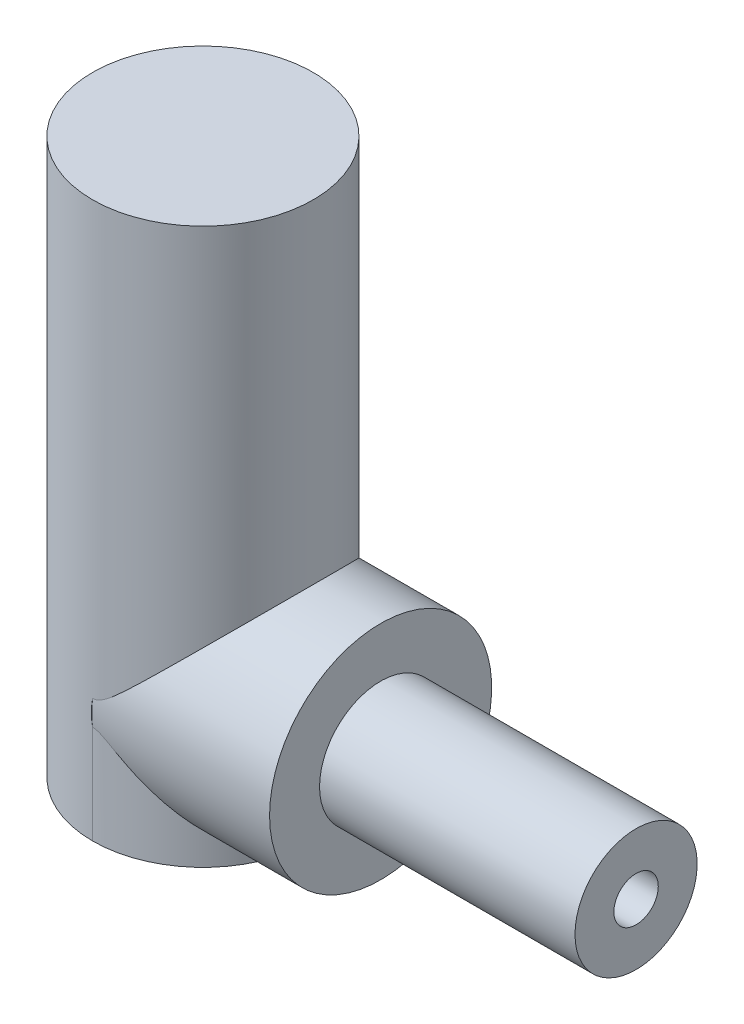
from build123d import *

# Parameters (mm, degrees)
SKETCH_2_R           = 1
CUT_EXTRUDE_1_DEPTH  = 8
EXTRUDE_1_DEPTH      = 20
EXTRUDE_1_DEPTH_BACK = 5
SKETCH_3_R           = 4.968098717


with BuildPart() as part:
    # 草图1 → 旋转2 (revolve)
    with BuildSketch(Plane(origin=(0, 0, 0), x_dir=(1, 0, 0), z_dir=(0, 1, 0))):
        Polygon((11.5, 0), (11.5, 2.75), (0, 2.75), (0, 5), (-8, 5), (-11, 3.25), (-11, 0), align=None)
    revolve(axis=Axis((-52.597365488, 0, 0), (1, 0, 0)))

    # 草图2 → 切除-拉伸1 (cut)
    with BuildSketch(Plane(origin=(11.5, 0, 0), x_dir=(0, 0, -1), z_dir=(1, 0, 0))):
        Circle(SKETCH_2_R)
    extrude(amount=-CUT_EXTRUDE_1_DEPTH, mode=Mode.SUBTRACT)

    # 草图3 → 凸台-拉伸1 (add, two sides: drawn at the far end of the back side and taken through both)
    with BuildSketch(Plane(origin=(0, 0, 0), x_dir=(1, 0, 0), z_dir=(0, 1, 0)).offset(-EXTRUDE_1_DEPTH_BACK)):
        with Locations((-8, 0)):
            Circle(SKETCH_3_R)
    extrude(amount=EXTRUDE_1_DEPTH + EXTRUDE_1_DEPTH_BACK)


solid = part.part
